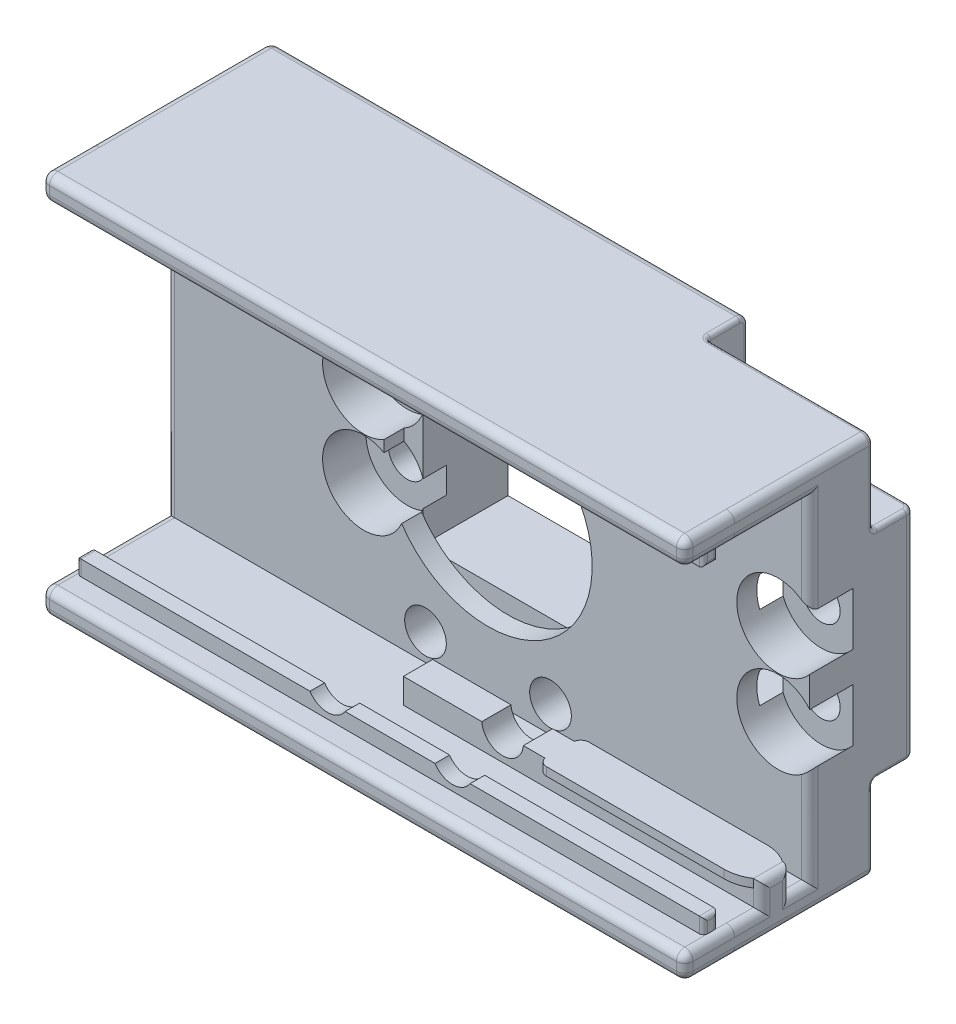
from build123d import *

# Parameters (mm, degrees)
SKETCH2_W                 = 77.2
SKETCH2_H                 = 40
SKETCH2_R                 = 12.5
BOSS_EXTRUDE1_DEPTH       = 2.4
SKETCH5_W                 = 60.3
SKETCH5_H                 = 40
SKETCH5_W_2               = 40.4
SKETCH5_H_2               = 20.6
BOSS_EXTRUDE4_DEPTH       = 10.2
SKETCH6_W                 = 5.9
SKETCH6_H                 = 1.7
CUT_EXTRUDE1_DEPTH        = 2
SKETCH9_W                 = 43
SKETCH9_H                 = 22.6
BOSS_EXTRUDE7_DEPTH       = 3
SKETCH10_W                = 43
SKETCH10_H                = 3.5
BOSS_EXTRUDE8_DEPTH       = 3
SKETCH20_W                = 22.6
SKETCH20_H                = 3
BOSS_EXTRUDE9_DEPTH       = 34.2
F_4_0MM_DOWEL_HOLE1_D     = 4.5
F_2_0MM_DOWEL_HOLE1_D     = 2
CIRPATTERN1_COUNT         = 2
CUT_EXTRUDE2_DEPTH        = 47.666047615
CUT_EXTRUDE2_DEPTH_BACK   = 5.2
SKETCH14_R                = 4.95
SKETCH14_R_2              = 2.5
SKETCH22_W                = 22.6
SKETCH22_H                = 3
BOSS_EXTRUDE10_DEPTH      = 34.2
FILLET1_R                 = 1
SKETCH23_W                = 20
SKETCH23_H                = 10
CUT_EXTRUDE3_DEPTH        = 5
FILLET2_R                 = 0.5
SKETCH24_W                = 25
SKETCH24_H                = 1
BOSS_EXTRUDE11_DEPTH      = 0.8
SKETCH25_W                = 25
SKETCH25_H                = 1
BOSS_EXTRUDE12_DEPTH      = 0.8
FILLET3_R                 = 5
SKETCH26_W                = 25
SKETCH26_H                = 1
BOSS_EXTRUDE13_DEPTH      = 0.8
SKETCH27_W                = 25
SKETCH27_H                = 1
BOSS_EXTRUDE14_DEPTH      = 0.8
FILLET4_R                 = 5
FILLET5_R                 = 1
BOSS_EXTRUDE15_DEPTH      = 5
BOSS_EXTRUDE15_DEPTH_BACK = 1
SKETCH28_W                = 77.2
SKETCH28_H                = 3
FILLET6_R                 = 1
SKETCH29_W                = 75.2
SKETCH29_H                = 1.75
BOSS_EXTRUDE16_DEPTH      = 1.85
FILLET7_R                 = 0.5
SKETCH30_W                = 75.2
SKETCH30_H                = 1.75
BOSS_EXTRUDE17_DEPTH      = 1.85
FILLET8_R                 = 0.5
SKETCH31_R                = 2.5
CUT_EXTRUDE4_DEPTH        = 1.75


with BuildPart() as part:
    # Sketch2 → Boss-Extrude1 (new body)
    with BuildSketch(Plane.XY):
        Rectangle(SKETCH2_W, SKETCH2_H)
        Circle(SKETCH2_R, mode=Mode.SUBTRACT)
    extrude(amount=BOSS_EXTRUDE1_DEPTH)

    # Sketch5 → Boss-Extrude4 (add)
    with BuildSketch(Plane(origin=(0, 0, 0), x_dir=(-1, 0, 0), z_dir=(0, 0, -1))):
        with Locations((-8.45, 0)):
            Rectangle(SKETCH5_W, SKETCH5_H)
        with Locations((-10, 0)):
            Rectangle(SKETCH5_W_2, SKETCH5_H_2, mode=Mode.SUBTRACT)
    extrude(amount=BOSS_EXTRUDE4_DEPTH)

    # Sketch6 → Cut-Extrude1 (cut)
    with BuildSketch(Plane(origin=(0, 0, -10.2), x_dir=(-1, 0, 0), z_dir=(0, 0, -1))):
        with Locations((-33.15, 0)):
            Rectangle(SKETCH6_W, SKETCH6_H)
    extrude(amount=-CUT_EXTRUDE1_DEPTH, mode=Mode.SUBTRACT)

    # Sketch9 → Boss-Extrude7 (add)
    with BuildSketch(Plane(origin=(0, 20, 0), x_dir=(1, 0, 0), z_dir=(0, 1, 0))):
        with Locations((-17.1, -1.1)):
            Rectangle(SKETCH9_W, SKETCH9_H)
    boss_extrude7 = extrude(amount=BOSS_EXTRUDE7_DEPTH)

    # Sketch10 → Boss-Extrude8 (add)
    with BuildSketch(Plane.XZ.offset(-20)):
        with Locations((-17.1, 6.4)):
            Rectangle(SKETCH10_W, SKETCH10_H)
    boss_extrude8 = extrude(amount=BOSS_EXTRUDE8_DEPTH)

    # Sketch20 → Boss-Extrude9 (add)
    with BuildSketch(Plane(origin=(4.4, 0, 0), x_dir=(0, 0, -1), z_dir=(1, 0, 0))):
        with Locations((-1.1, 21.5)):
            Rectangle(SKETCH20_W, SKETCH20_H)
    extrude(amount=BOSS_EXTRUDE9_DEPTH)

    # Ø4.0mm Dowel Hole1 (through all)
    with Locations(Plane(origin=(0, 0, -10.2), x_dir=(-1, 0, 0), z_dir=(0, 0, -1))):
        with Locations((-34.8, 5), (-34.8, -5), (14.9, -5), (14.9, 5)):
            Hole(F_4_0MM_DOWEL_HOLE1_D / 2)

    # Ø2.0mm Dowel Hole1 (through all)
    with Locations(Plane(origin=(0, 0, -10.2), x_dir=(-1, 0, 0), z_dir=(0, 0, -1))):
        with Locations((-7.5, 16.8), (7.5, 16.8)):
            f_2_0mm_dowel_hole1 = Hole(F_2_0MM_DOWEL_HOLE1_D / 2)

    # Mirror10: Ø2.0mm Dowel Hole1 across plane
    add(f_2_0mm_dowel_hole1.mirror(Plane.ZX), mode=Mode.SUBTRACT)

    # CirPattern1: Boss-Extrude7, Boss-Extrude8 ×2 about axis
    cirpattern1_axis = Axis((0, 0, 0), (0, 0, 1))
    add([boss_extrude7.rotate(cirpattern1_axis, i * 360 / CIRPATTERN1_COUNT) for i in range(1, CIRPATTERN1_COUNT)])
    add([boss_extrude8.rotate(cirpattern1_axis, i * 360 / CIRPATTERN1_COUNT) for i in range(1, CIRPATTERN1_COUNT)])

    # Sketch14 → Cut-Extrude2 (cut, two sides: drawn at the far end of the back side and taken through both)
    with BuildSketch(Plane.XY.offset(2.4).offset(-CUT_EXTRUDE2_DEPTH_BACK)):
        with Locations((-14.9, 5)):
            Circle(SKETCH14_R)
        with Locations((-14.9, -5)):
            Circle(SKETCH14_R)
        with Locations((-7.5, 16.8)):
            Circle(SKETCH14_R_2)
        with Locations((7.5, 16.8)):
            Circle(SKETCH14_R_2)
        with Locations((34.8, 5)):
            Circle(SKETCH14_R)
        with Locations((34.8, -5)):
            Circle(SKETCH14_R)
        with Locations((-7.5, -16.8)):
            Circle(SKETCH14_R_2)
        with Locations((7.5, -16.8)):
            Circle(SKETCH14_R_2)
    extrude(amount=CUT_EXTRUDE2_DEPTH + CUT_EXTRUDE2_DEPTH_BACK, mode=Mode.SUBTRACT)

    # Sketch22 → Boss-Extrude10 (add)
    with BuildSketch(Plane.ZY.offset(4.4)):
        with Locations((1.1, -21.5)):
            Rectangle(SKETCH22_W, SKETCH22_H)
    extrude(amount=BOSS_EXTRUDE10_DEPTH)

    # Fillet1
    fillet1_edges = [part.edges().sort_by_distance(p)[0] for p in [
        (38.6, 20, 7.4),
        (0, 20, 12.4),
        (-38.6, 20, 10.275),
        (-38.6, 20, 3.525),
        (-38.6, 0, 2.4),
        (38.6, 14.086072193, 2.4),
        (38.6, -14.086072193, 2.4),
        (-38.6, 21.5, -10.2),
        (-30.15, 20, -10.2),
        (-21.7, 0, -10.2),
        (-30.15, -20, -10.2),
        (0, -23, -10.2),
        (38.6, 0, -10.2),
        (0, 23, -10.2),
        (38.6, 23, 1.1),
        (0, 23, 12.4),
        (-38.6, 23, 1.1),
        (-38.6, -23, 1.1),
        (0, -23, 12.4),
        (38.6, -23, 1.1),
        (0, -20, 12.4),
        (-38.6, -21.5, 12.4),
        (-30.15, -20, 0),
        (-21.7, -20, -5.1),
        (-38.6, -20, -5.1),
        (-38.6, 0, 0),
        (-21.7, 0, 0),
        (-30.15, 20, 0),
        (-21.7, 20, -5.1),
        (-38.6, 20, -5.1),
        (38.6, -20, 3.525),
        (-38.6, -20, 7.4),
        (38.6, -20, 10.275),
        (38.6, -18.5, 4.65),
        (38.6, -17, 6.4),
        (38.6, -18.5, 8.15),
        (-38.6, 18.5, 4.65),
        (-38.6, 17, 6.4),
        (-38.6, 18.5, 8.15),
        (-38.6, 21.5, 12.4),
        (38.6, 21.5, 12.4),
    ]]
    fillet(fillet1_edges, radius=FILLET1_R)

    # Sketch23 → Cut-Extrude3 (cut)
    with BuildSketch(Plane(origin=(0, 0, -10.2), x_dir=(-1, 0, 0), z_dir=(0, 0, -1))):
        with Locations((-28.6, 18)):
            Rectangle(SKETCH23_W, SKETCH23_H)
        with Locations((-28.6, -18)):
            Rectangle(SKETCH23_W, SKETCH23_H)
    extrude(amount=-CUT_EXTRUDE3_DEPTH, mode=Mode.SUBTRACT)

    # Fillet2
    fillet2_edges = [part.edges().sort_by_distance(p)[0] for p in [
        (18.6, 22.707106781, -9.907106781),
        (38.307106781, 22.707106781, -5.2),
        (38.307106781, -13, -9.907106781),
        (38.307106781, 13, -9.907106781),
        (38.307106781, -22.707106781, -5.2),
        (18.6, -22.707106781, -9.907106781),
        (28.1, 23, -5.2),
        (28.1, 13, -10.2),
        (18.6, 17.5, -10.2),
        (18.6, 18, -5.2),
        (18.6, 23, -7.2),
        (28.6, 13, -5.2),
        (18.6, 13, -7.7),
        (38.6, 17.5, -5.2),
        (38.6, 13, -7.2),
        (18.6, -18, -5.2),
        (18.6, -13, -7.7),
        (28.1, -23, -5.2),
        (18.6, -23, -7.2),
        (38.6, -17.5, -5.2),
        (28.6, -13, -5.2),
        (38.6, -13, -7.2),
        (18.6, -17.5, -10.2),
        (28.1, -13, -10.2),
    ]]
    fillet(fillet2_edges, radius=FILLET2_R)

    # Sketch24 → Boss-Extrude11 (add)
    with BuildSketch(Plane(origin=(0, 0, 4.65), x_dir=(-1, 0, 0), z_dir=(0, 0, -1))):
        with Locations((25.1, 17.5)):
            Rectangle(SKETCH24_W, SKETCH24_H)
    extrude(amount=BOSS_EXTRUDE11_DEPTH)

    # Sketch25 → Boss-Extrude12 (add)
    with BuildSketch(Plane.XY.offset(8.15)):
        with Locations((-25.1, 17.5)):
            Rectangle(SKETCH25_W, SKETCH25_H)
    extrude(amount=BOSS_EXTRUDE12_DEPTH)

    # Fillet3
    # the kernel refuses this fillet: 5 mm, written as the material it takes off along each edge
    with BuildSketch(Plane(origin=(-37.6, 18, 3.85), x_dir=(6.563638521517199e-12, 0, 1.0), z_dir=(0, -1, 0))) as fillet3_piece_1:
        with BuildLine():
            CenterArc((5, -2.712931993), FILLET3_R, 147.140119621, 32.859880379)
            Line((0, -2.712931993), (-0.1, -2.712931993))
            Line((-0.1, -2.712931993), (-0.1, 0))
            Line((-0.1, 0), (0, 0.1))
            ThreePointArc((0, 0.1), (0.4, 0.1), (0.716, 0.05425864))
            Line((0.716, 0.05425864), (0.8, 0))
        make_face()
    extrude(amount=1, mode=Mode.SUBTRACT)
    with BuildSketch(Plane(origin=(-37.6, 18, 8.95), x_dir=(6.563638521517199e-12, 0, -1.0), z_dir=(0, -1, 0))) as fillet3_piece_2:
        with BuildLine():
            CenterArc((5, 2.712931993), FILLET3_R, 180, 32.859880379)
            Line((0, 2.712931993), (-0.1, 2.712931993))
            Line((-0.1, 2.712931993), (-0.1, 0))
            Line((-0.1, 0), (0, -0.1))
            ThreePointArc((0, -0.1), (0.4, -0.1), (0.716, -0.05425864))
            Line((0.716, -0.05425864), (0.8, 0))
        make_face()
    extrude(amount=1, mode=Mode.SUBTRACT)

    # Sketch26 → Boss-Extrude13 (add)
    with BuildSketch(Plane.XY.offset(8.15)):
        with Locations((25.1, -17.5)):
            Rectangle(SKETCH26_W, SKETCH26_H)
    extrude(amount=BOSS_EXTRUDE13_DEPTH)

    # Sketch27 → Boss-Extrude14 (add)
    with BuildSketch(Plane(origin=(0, 0, 4.65), x_dir=(-1, 0, 0), z_dir=(0, 0, -1))):
        with Locations((-25.1, -17.5)):
            Rectangle(SKETCH27_W, SKETCH27_H)
    extrude(amount=BOSS_EXTRUDE14_DEPTH)

    # Fillet4
    # the kernel refuses this fillet: 5 mm, written as the material it takes off along each edge
    with BuildSketch(Plane(origin=(37.6, -18, 3.85), x_dir=(-6.57252030571411e-12, 0, 1.0), z_dir=(0, 1, 0))) as fillet4_piece_1:
        with BuildLine():
            CenterArc((5, -2.712931993), FILLET4_R, 147.140119621, 32.859880379)
            Line((0, -2.712931993), (-0.1, -2.712931993))
            Line((-0.1, -2.712931993), (-0.1, 0))
            Line((-0.1, 0), (0, 0.1))
            ThreePointArc((0, 0.1), (0.4, 0.1), (0.716, 0.05425864))
            Line((0.716, 0.05425864), (0.8, 0))
        make_face()
    extrude(amount=1, mode=Mode.SUBTRACT)
    with BuildSketch(Plane(origin=(37.6, -18, 8.95), x_dir=(-6.57252030571411e-12, 0, -1.0), z_dir=(0, 1, 0))) as fillet4_piece_2:
        with BuildLine():
            CenterArc((5, 2.712931993), FILLET4_R, 180, 32.859880379)
            Line((0, 2.712931993), (-0.1, 2.712931993))
            Line((-0.1, 2.712931993), (-0.1, 0))
            Line((-0.1, 0), (0, -0.1))
            ThreePointArc((0, -0.1), (0.4, -0.1), (0.716, -0.05425864))
            Line((0.716, -0.05425864), (0.8, 0))
        make_face()
    extrude(amount=1, mode=Mode.SUBTRACT)

    # Fillet5
    # the kernel refuses this fillet: 1 mm, written as the material it takes off along each edge
    with BuildSketch(Plane(origin=(12.6, -14.550510257, 3.85), x_dir=(1, 0, 0), z_dir=(0, -1, 0))) as fillet5_piece_1:
        with BuildLine():
            CenterArc((0.979795897, 1), FILLET5_R, 191.536959033, 78.463040967)
            Line((0, 0.8), (0, 0))
            Line((0, 0), (0.979795897, 0))
        make_face()
    extrude(amount=3.449489743, mode=Mode.SUBTRACT)
    with BuildSketch(Plane(origin=(12.6, -14.550510257, 8.95), x_dir=(1.569855356819468e-12, 0, -1.0), z_dir=(0, -1, 0)), Plane(origin=(-12.6, 14.550510257, 8.95), x_dir=(-1.569855356819468e-12, 0, -1.0), z_dir=(0, 1, 0))) as fillet5_piece_2:
        with BuildLine():
            CenterArc((1, 0.979795897), FILLET5_R, 180, 78.463040967)
            Line((0, 0.979795897), (0, 0))
            Line((0, 0), (0.8, 0))
        make_face()
    extrude(amount=3.449489743, mode=Mode.SUBTRACT)
    with BuildSketch(Plane(origin=(-12.6, 14.550510257, 3.85), x_dir=(-1.5720758028687176e-12, 0, 1.0), z_dir=(0, 1, 0))) as fillet5_piece_3:
        with BuildLine():
            CenterArc((1, -0.979795897), FILLET5_R, 101.536959033, 78.463040967)
            Line((0, -0.979795897), (0, 0))
            Line((0, 0), (0.8, 0))
        make_face()
    extrude(amount=3.449489743, mode=Mode.SUBTRACT)

    # Sketch28 → Boss-Extrude15 (add, two sides: drawn at the far end of the back side and taken through both)
    with BuildSketch(Plane.XY.offset(12.4).offset(-BOSS_EXTRUDE15_DEPTH_BACK)):
        with Locations((0, -21.5)):
            Rectangle(SKETCH28_W, SKETCH28_H)
        with Locations((0, 21.5)):
            Rectangle(SKETCH28_W, SKETCH28_H)
    extrude(amount=BOSS_EXTRUDE15_DEPTH + BOSS_EXTRUDE15_DEPTH_BACK)

    # Fillet6
    fillet6_edges = [part.edges().sort_by_distance(p)[0] for p in [
        (-38.6, -23, 14.4),
        (-38.6, -20, 14.4),
        (38.6, -20, 14.4),
        (38.6, -23, 14.4),
        (-38.6, -21.5, 17.4),
        (0, -23, 17.4),
        (38.6, -21.5, 17.4),
        (0, -20, 17.4),
        (-38.6, 20, 14.4),
        (-38.6, 23, 14.4),
        (38.6, 23, 14.4),
        (38.6, 20, 14.4),
        (-38.6, 21.5, 17.4),
        (0, 20, 17.4),
        (38.6, 21.5, 17.4),
        (0, 23, 17.4),
    ]]
    fillet(fillet6_edges, radius=FILLET6_R)

    # Sketch29 → Boss-Extrude16 (add)
    with BuildSketch(Plane(origin=(0, -20, 0), x_dir=(1, 0, 0), z_dir=(0, 1, 0))):
        with Locations((0, -13.275)):
            Rectangle(SKETCH29_W, SKETCH29_H)
    extrude(amount=BOSS_EXTRUDE16_DEPTH)

    # Fillet7
    fillet7_edges = [part.edges().sort_by_distance(p)[0] for p in [
        (-37.6, -19.075, 12.4),
        (-37.6, -19.075, 14.15),
        (37.6, -19.075, 14.15),
        (37.6, -19.075, 12.4),
        (-37.6, -18.15, 13.275),
        (37.6, -18.15, 13.275),
    ]]
    fillet(fillet7_edges, radius=FILLET7_R)

    # Sketch30 → Boss-Extrude17 (add)
    with BuildSketch(Plane.XZ.offset(-20)):
        with Locations((0, 13.275)):
            Rectangle(SKETCH30_W, SKETCH30_H)
    extrude(amount=BOSS_EXTRUDE17_DEPTH)

    # Fillet8
    fillet8_edges = [part.edges().sort_by_distance(p)[0] for p in [
        (37.6, 19.075, 12.4),
        (37.6, 19.075, 14.15),
        (-37.6, 19.075, 14.15),
        (-37.6, 19.075, 12.4),
        (37.6, 18.15, 13.275),
        (-37.6, 18.15, 13.275),
    ]]
    fillet(fillet8_edges, radius=FILLET8_R)

    # Sketch31 → Cut-Extrude4 (cut)
    with BuildSketch(Plane.XY.offset(14.15)):
        with Locations((7.5, -16.8)):
            Circle(SKETCH31_R)
        with Locations((-7.5, -16.8)):
            Circle(SKETCH31_R)
        with Locations((7.5, 16.8)):
            Circle(SKETCH31_R)
        with Locations((-7.5, 16.8)):
            Circle(SKETCH31_R)
    extrude(amount=-CUT_EXTRUDE4_DEPTH, mode=Mode.SUBTRACT)


solid = part.part
